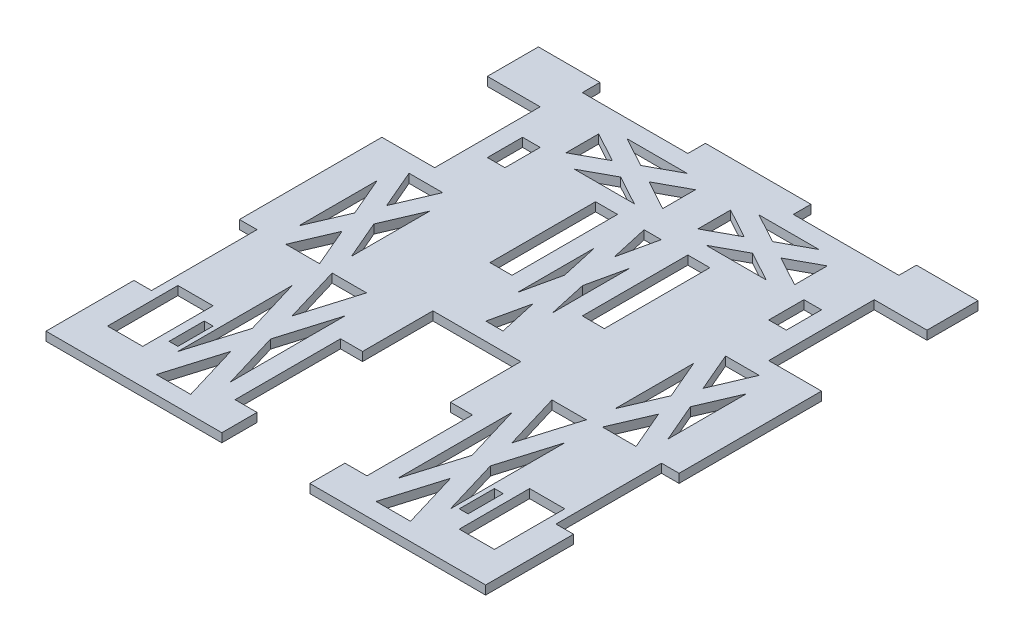
from build123d import *

# Parameters (mm, degrees)
SKETCH1_W           = 317.5
SKETCH1_H           = 355.6
BOSS_EXTRUDE1_DEPTH = 6.35
SKETCH2_W           = 63.5
SKETCH2_H           = 152.4
CUT_EXTRUDE1_DEPTH  = 239.442288615
SKETCH3_W           = 25.4
SKETCH3_H           = 76.2
SKETCH3_W_2         = 12.7
SKETCH3_H_2         = 25.4
CUT_EXTRUDE2_DEPTH  = 239.442288615
SKETCH4_W           = 12.7
SKETCH4_H           = 76.2
SKETCH4_W_2         = 76.2
SKETCH4_H_2         = 12.7
SKETCH4_W_3         = 15.875
CUT_EXTRUDE3_DEPTH  = 239.442288615
SKETCH5_W           = 25.4
SKETCH5_H           = 50.8
SKETCH5_W_2         = 6.35
SKETCH5_H_2         = 25.4
CUT_EXTRUDE4_DEPTH  = 239.442288615


with BuildPart() as part:
    # Sketch1 → Boss-Extrude1 (new body)
    with BuildSketch(Plane(origin=(0, 0, 0), x_dir=(1, 0, 0), z_dir=(0, 1, 0))):
        Rectangle(SKETCH1_W, SKETCH1_H)
    extrude(amount=BOSS_EXTRUDE1_DEPTH)

    # Sketch2 → Cut-Extrude1 (cut, through all)
    with BuildSketch(Plane(origin=(0, 6.35, 0), x_dir=(1, 0, 0), z_dir=(0, 1, 0))):
        with Locations((0, -101.6)):
            Rectangle(SKETCH2_W, SKETCH2_H)
    extrude(amount=-CUT_EXTRUDE1_DEPTH, mode=Mode.SUBTRACT)

    # Sketch3 → Cut-Extrude2 (cut, through all)
    with BuildSketch(Plane(origin=(0, 6.35, 0), x_dir=(1, 0, 0), z_dir=(0, 1, 0))):
        with Locations((133.35, 102.87)):
            Rectangle(SKETCH3_W, SKETCH3_H)
        with Locations((101.6, 102.87)):
            Rectangle(SKETCH3_W_2, SKETCH3_H_2)
        with Locations((-101.6, 102.87)):
            Rectangle(SKETCH3_W_2, SKETCH3_H_2)
        with Locations((-133.35, 102.87)):
            Rectangle(SKETCH3_W, SKETCH3_H)
    extrude(amount=-CUT_EXTRUDE2_DEPTH, mode=Mode.SUBTRACT)

    # Sketch4 → Cut-Extrude3 (cut, through all)
    with BuildSketch(Plane(origin=(0, 6.35, 0), x_dir=(1, 0, 0), z_dir=(0, 1, 0))):
        with Locations((-152.4, 102.87)):
            Rectangle(SKETCH4_W, SKETCH4_H)
        with Locations((-152.4, -76.2)):
            Rectangle(SKETCH4_W, SKETCH4_H)
        with Locations((152.4, 102.87)):
            Rectangle(SKETCH4_W, SKETCH4_H)
        with Locations((152.4, -76.2)):
            Rectangle(SKETCH4_W, SKETCH4_H)
        with Locations((76.2, 171.45)):
            Rectangle(SKETCH4_W_2, SKETCH4_H_2)
        with Locations((-76.2, 171.45)):
            Rectangle(SKETCH4_W_2, SKETCH4_H_2)
        with Locations((-39.6875, -114.3)):
            Rectangle(SKETCH4_W_3, SKETCH4_H)
        with Locations((33.3375, 63.5)):
            Rectangle(SKETCH4_W_3, SKETCH4_H)
        with Locations((-33.3375, 63.5)):
            Rectangle(SKETCH4_W_3, SKETCH4_H)
        with Locations((39.6875, -114.3)):
            Rectangle(SKETCH4_W_3, SKETCH4_H)
    extrude(amount=-CUT_EXTRUDE3_DEPTH, mode=Mode.SUBTRACT)

    # Sketch5 → Cut-Extrude4 (cut, through all)
    with BuildSketch(Plane(origin=(0, 6.35, 0), x_dir=(1, 0, 0), z_dir=(0, 1, 0))):
        Polygon((-79.375, -123.698648777), (-91.795405367, -165.1), (-66.954594633, -165.1), align=None)
        Polygon((-98.425, -60.198648777), (-98.425, -143.001351223), (-86.004594633, -101.6), align=None)
        Polygon((-60.325, -60.198648777), (-72.745405367, -101.6), (-60.325, -143.001351223), align=None)
        Polygon((-91.795405367, -38.1), (-79.375, -79.501351223), (-66.954594633, -38.1), align=None)
        Polygon((-114.3, -8.500053074), (-126.441405825, -36.83), (-102.158594175, -36.83), align=None)
        Polygon((-133.35, 35.949946926), (-133.35, -20.709946926), (-121.208594175, 7.62), align=None)
        Polygon((-95.25, 35.949946926), (-107.391405825, 7.62), (-95.25, -20.709946926), align=None)
        Polygon((-126.441405825, 52.07), (-114.3, 23.740053074), (-102.158594175, 52.07), align=None)
        Polygon((-47.625, 126.116793459), (-69.289121342, 114.3), (-25.960878658, 114.3), align=None)
        Polygon((-82.55, 145.166793459), (-82.55, 121.533206541), (-60.885878658, 133.35), align=None)
        Polygon((-12.7, 145.166793459), (-34.364121342, 133.35), (-12.7, 121.533206541), align=None)
        Polygon((-69.289121342, 152.4), (-47.625, 140.583206541), (-25.960878658, 152.4), align=None)
        Polygon((0, 15.177946348), (-6.195099188, -12.7), (6.195099188, -12.7), align=None)
        Polygon((-12.7, 72.327946348), (-12.7, 16.572053652), (-6.504900812, 44.45), align=None)
        Polygon((12.7, 72.327946348), (6.504900812, 44.45), (12.7, 16.572053652), align=None)
        Polygon((-6.195099188, 101.6), (0, 73.722053652), (6.195099188, 101.6), align=None)
        with Locations((-127, -127)):
            Rectangle(SKETCH5_W, SKETCH5_H)
        with Locations((-104.775, -127)):
            Rectangle(SKETCH5_W_2, SKETCH5_H_2)
    cut_extrude4 = extrude(amount=-CUT_EXTRUDE4_DEPTH, mode=Mode.SUBTRACT)

    # Mirror1: Cut-Extrude4 across plane
    add(cut_extrude4.mirror(Plane(origin=(0, 0, 0), x_dir=(0, 0, 1), z_dir=(1, 0, 0))), mode=Mode.SUBTRACT)


solid = part.part
